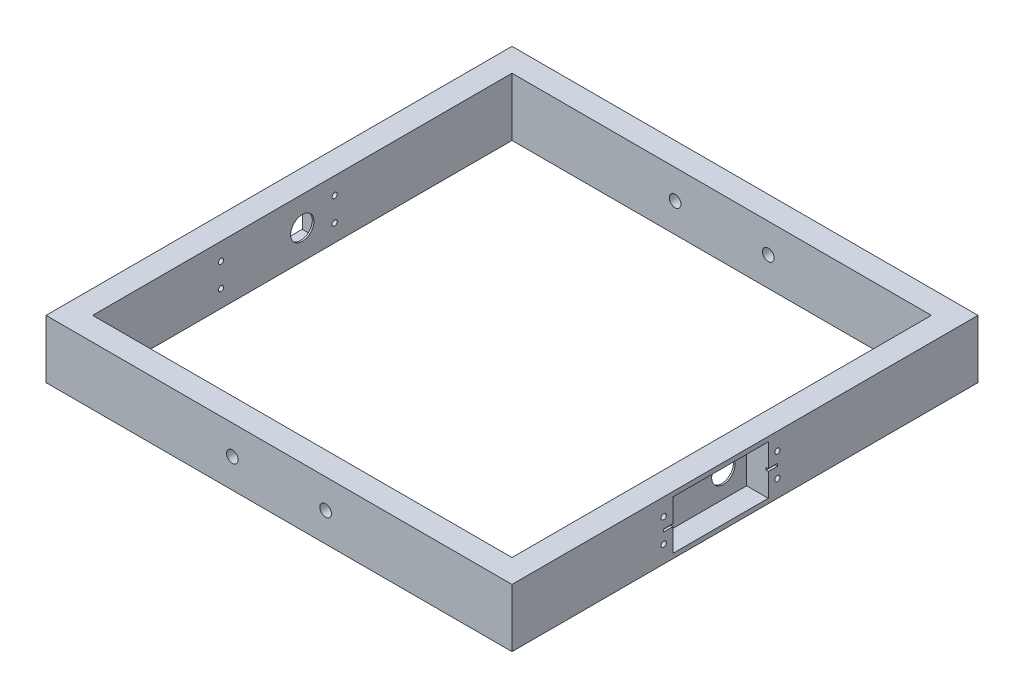
from build123d import *

# Parameters (mm, degrees)
SKETCH1_W                                  = 200
SKETCH1_H                                  = 200
BOSS_EXTRUDE1_DEPTH                        = 25
SKETCH2_W                                  = 180
SKETCH2_H                                  = 180
CUT_EXTRUDE1_DEPTH                         = 25
SKETCH19_W                                 = 41
SKETCH19_H                                 = 21
CUT_EXTRUDE10_DEPTH                        = 9.3
SKETCH20_R                                 = 5
CUT_EXTRUDE11_DEPTH                        = 9.3
SKETCH23_W                                 = 49
SKETCH23_H                                 = 1.1
CUT_EXTRUDE14_DEPTH                        = 1
SKETCH21_R                                 = 1.125
CUT_EXTRUDE12_DEPTH                        = 10
MIRROR1_AT_THE_SECOND_PLANE_COPY_1_SKETC_R = 1.125
MIRROR1_AT_THE_SECOND_PLANE_COPY_1_DEPTH   = 10
MIRROR2_COPY_1_SKETCH_R                    = 1.125
MIRROR2_COPY_1_DEPTH                       = 10
MIRROR2_COPY_2_SKETCH_R                    = 1.125
MIRROR2_COPY_2_DEPTH                       = 10
MIRROR2_COPY_3_SKETCH_R                    = 1.125
MIRROR2_COPY_3_DEPTH                       = 10
SKETCH22_R                                 = 2.5
CUT_EXTRUDE13_DEPTH                        = 226


with BuildPart() as part:
    # Sketch1 → Boss-Extrude1 (new body)
    with BuildSketch(Plane(origin=(0, 0, 0), x_dir=(1, 0, 0), z_dir=(0, 1, 0))):
        Rectangle(SKETCH1_W, SKETCH1_H)
    extrude(amount=BOSS_EXTRUDE1_DEPTH)

    # Sketch2 → Cut-Extrude1 (cut)
    with BuildSketch(Plane(origin=(0, 25, 0), x_dir=(1, 0, 0), z_dir=(0, 1, 0))):
        Rectangle(SKETCH2_W, SKETCH2_H)
    extrude(amount=-CUT_EXTRUDE1_DEPTH, mode=Mode.SUBTRACT)

    # Sketch19 → Cut-Extrude10 (cut)
    with BuildSketch(Plane.ZY.offset(100)):
        with Locations((10.5, 12.5)):
            Rectangle(SKETCH19_W, SKETCH19_H)
    cut_extrude10 = extrude(amount=-CUT_EXTRUDE10_DEPTH, mode=Mode.SUBTRACT)

    # Sketch20 → Cut-Extrude11 (cut)
    with BuildSketch(Plane.ZY.offset(90.7)):
        with Locations((0, 12.5)):
            Circle(SKETCH20_R)
    cut_extrude11 = extrude(amount=-CUT_EXTRUDE11_DEPTH, mode=Mode.SUBTRACT)

    # Sketch23 → Cut-Extrude14 (cut)
    with BuildSketch(Plane.ZY.offset(100)):
        with Locations((10.5, 12.5)):
            Rectangle(SKETCH23_W, SKETCH23_H)
    cut_extrude14 = extrude(amount=-CUT_EXTRUDE14_DEPTH, mode=Mode.SUBTRACT)

    # Sketch21 → Cut-Extrude12 (cut)
    with BuildSketch(Plane.ZY.offset(100)):
        with Locations((-13.9, 17.6)):
            Circle(SKETCH21_R)
    cut_extrude12 = extrude(amount=-CUT_EXTRUDE12_DEPTH, mode=Mode.SUBTRACT)

    # Mirror1: Cut-Extrude12 across plane
    add(cut_extrude12.mirror(Plane.XY.offset(10.5)), mode=Mode.SUBTRACT)

    # Mirror1 at the second plane: Cut-Extrude12 across plane
    add(cut_extrude12.mirror(Plane.ZX.offset(12.5)), mode=Mode.SUBTRACT)

    # Mirror1 at the second plane copy 1 sketc → Mirror1 at the second plane copy 1 (cut)
    with BuildSketch(Plane(origin=(-100, 25, 21), x_dir=(0, 0, -1), z_dir=(-1, 0, 0))):
        with Locations((-13.9, 17.6)):
            Circle(MIRROR1_AT_THE_SECOND_PLANE_COPY_1_SKETC_R)
    extrude(amount=-MIRROR1_AT_THE_SECOND_PLANE_COPY_1_DEPTH, mode=Mode.SUBTRACT)

    # Mirror2: Cut-Extrude10, Cut-Extrude11, Cut-Extrude14, Cut-Extrude12 across plane
    add(cut_extrude10.mirror(Plane.ZY), mode=Mode.SUBTRACT)
    add(cut_extrude11.mirror(Plane.ZY), mode=Mode.SUBTRACT)
    add(cut_extrude14.mirror(Plane.ZY), mode=Mode.SUBTRACT)
    add(cut_extrude12.mirror(Plane.ZY), mode=Mode.SUBTRACT)

    # Mirror2 copy 1 sketch → Mirror2 copy 1 (cut)
    with BuildSketch(Plane(origin=(100, 0, 21), x_dir=(0, 0, -1), z_dir=(1, 0, 0))):
        with Locations((-13.9, 17.6)):
            Circle(MIRROR2_COPY_1_SKETCH_R)
    extrude(amount=-MIRROR2_COPY_1_DEPTH, mode=Mode.SUBTRACT)

    # Mirror2 copy 2 sketch → Mirror2 copy 2 (cut)
    with BuildSketch(Plane(origin=(100, 25, 0), x_dir=(0, 0, 1), z_dir=(1, 0, 0))):
        with Locations((-13.9, 17.6)):
            Circle(MIRROR2_COPY_2_SKETCH_R)
    extrude(amount=-MIRROR2_COPY_2_DEPTH, mode=Mode.SUBTRACT)

    # Mirror2 copy 3 sketch → Mirror2 copy 3 (cut)
    with BuildSketch(Plane(origin=(100, 25, 21), x_dir=(0, 0, -1), z_dir=(1, 0, 0))):
        with Locations((-13.9, -17.6)):
            Circle(MIRROR2_COPY_3_SKETCH_R)
    extrude(amount=-MIRROR2_COPY_3_DEPTH, mode=Mode.SUBTRACT)

    # Sketch22 → Cut-Extrude13 (cut, through all)
    with BuildSketch(Plane.XY.offset(100)):
        with Locations((-20, 12.5)):
            Circle(SKETCH22_R)
        with Locations((20, 12.5)):
            Circle(SKETCH22_R)
    extrude(amount=-CUT_EXTRUDE13_DEPTH, mode=Mode.SUBTRACT)


solid = part.part
